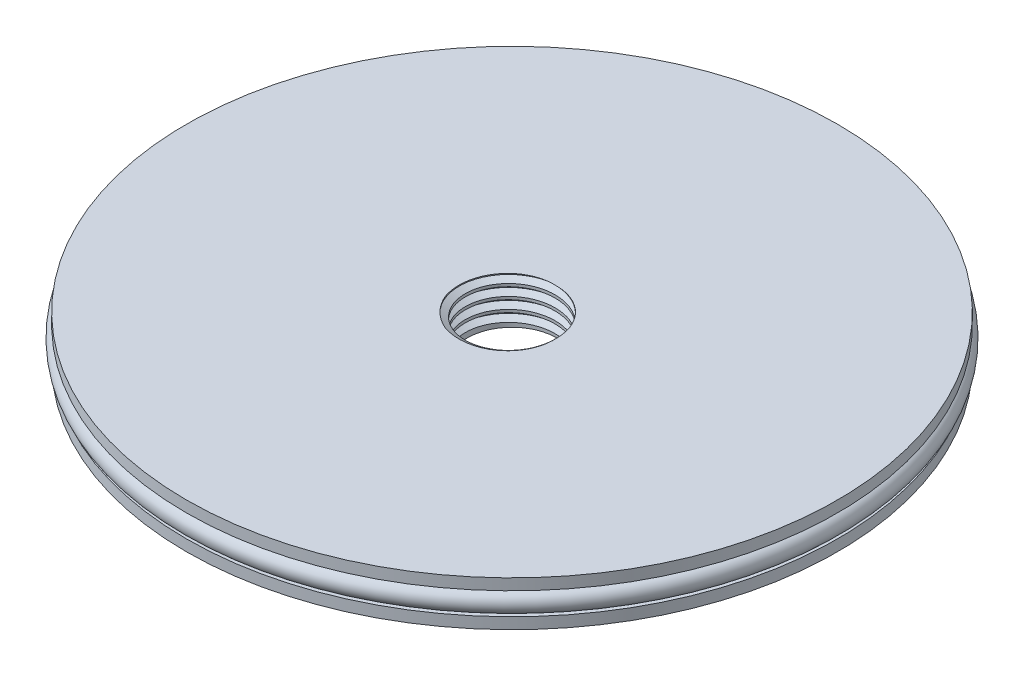
from build123d import *

# Parameters (mm, degrees)
SKETCH4_R          = 2.4
SKETCH9_R          = 10
CUT_EXTRUDE2_DEPTH = 10
THREAD1_PITCH      = 2.5


with BuildPart() as part:
    # Sketch2 → Revolve1 (revolve)
    with BuildSketch(Plane.XY, mode=Mode.PRIVATE) as revolve1_sk:
        Polygon((0, 0), (-72.5, 0), (-72.5, 2.5), (-68.5, 2.5), (-68.5, 7.5), (-72.5, 7.5), (-72.5, 10), (0, 10), align=None)
    revolve(revolve1_sk.sketch.rotate(Axis((0, 0, 0), (0, 1, 0)), 270), axis=Axis((0, 0, 0), (0, 1, 0)))

    # Sketch9 → Cut-Extrude2 (cut)
    with BuildSketch(Plane(origin=(0, 10, 0), x_dir=(1, 0, 0), z_dir=(0, 1, 0))):
        with Locations(Location((0, 0, 0), (0, 0, 270))):
            Circle(SKETCH9_R)
    extrude(amount=-CUT_EXTRUDE2_DEPTH, mode=Mode.SUBTRACT)

    # Thread1: the profile of Thread Profile1 profile screwed along a right-hand helix of 4 turns, 10 arcs to a turn; built about Z, then put on its axis
    thread1_z = Axis((0, 0, 0), (0, 0, 1))
    thread1_corners = [(9.9997, 0, -0.000173205), (11.353164687, 0, 0.781249997), (11.353164687, 0, 1.093749997), (9.9997, 0, 1.875173198)]
    with BuildLine(mode=Mode.PRIVATE) as thread1_profile:
        Line(thread1_corners[0], thread1_corners[1])
        Line(thread1_corners[1], thread1_corners[2])
        Line(thread1_corners[2], thread1_corners[3])
        Line(thread1_corners[3], thread1_corners[0])
    thread1_cap = Face(thread1_profile.wire())
    thread1_turn_angles = [0, 18, 36, 54, 72, 90, 108, 126, 144, 162, 180, 198, 216, 234, 252, 270, 288, 306, 324, 342, 360]
    thread1_turn_weights = [1, 0.9510565162951535, 1, 0.9510565162951535, 1, 0.9510565162951535, 1, 0.9510565162951535, 1, 0.9510565162951535, 1, 0.9510565162951535, 1, 0.9510565162951535, 1, 0.9510565162951535, 1, 0.9510565162951535, 1, 0.9510565162951535, 1]
    thread1_turn_rails = [Edge.make_bspline([Vector(p[0], p[1], 0).rotate(thread1_z, thread1_turn_angles[k]) / thread1_turn_weights[k] + Vector(0, 0, p[2] + THREAD1_PITCH * thread1_turn_angles[k] / 360) for k in range(21)], [0, 0, 0, 1, 1, 2, 2, 3, 3, 4, 4, 5, 5, 6, 6, 7, 7, 8, 8, 9, 9, 10, 10, 10], 2, thread1_turn_weights) for p in thread1_corners]
    thread1_turn_sides = [Face.make_surface_from_curves(thread1_turn_rails[p[0]], thread1_turn_rails[p[1]]) for p in [(0, 1), (1, 2), (2, 3), (3, 0)]]
    thread1 = Plane(origin=(0, 0, 0), x_dir=(1, 0, 0), z_dir=(0, 1, 0)) * Solid(Shell([*[p.moved(Location((0, 0, THREAD1_PITCH * i))) for i in range(4) for p in thread1_turn_sides], thread1_cap, thread1_cap.rotate(thread1_z, 1440).moved(Location((0, 0, THREAD1_PITCH * 1440 / 360)))]))
    add(thread1, mode=Mode.SUBTRACT)


with BuildPart() as body_2:
    # Sketch4 → Revolve2 (revolve)
    with BuildSketch(Plane.XY, mode=Mode.PRIVATE) as revolve2_sk:
        with Locations((-71, 5)):
            Circle(SKETCH4_R)
    revolve(revolve2_sk.sketch.rotate(Axis((0, 0, 0), (0, 1, 0)), 270), axis=Axis((0, 0, 0), (0, 1, 0)))


solid = Compound([part.part, body_2.part])
